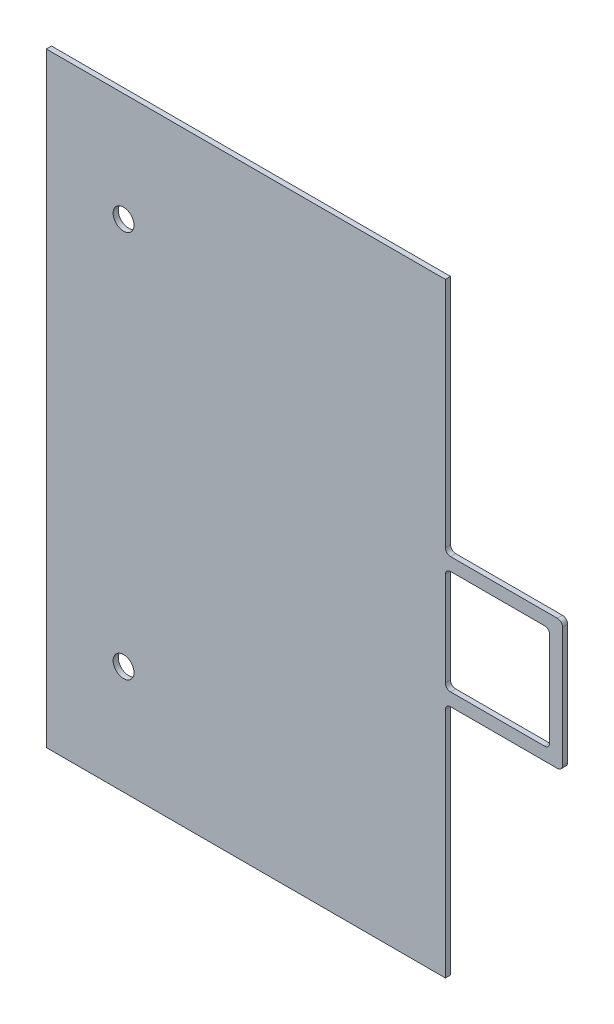
from build123d import *

# Parameters (mm, degrees)
SKETCH9_R          = 8.1
BASE_FLANGE2_DEPTH = 4


# Sheet-metal steps are written as plain solids
with BuildPart() as part:
    # Sketch9 → Base-Flange2 (new body)
    with BuildSketch(Plane.XY):
        with BuildLine():
            Line((-155, -235), (155, -235))
            Line((155, -235), (155, -54.5))
            ThreePointArc((155, -54.5), (156.171572875, -51.671572875), (159, -50.5))
            Line((159, -50.5), (242, -50.5))
            ThreePointArc((242, -50.5), (244.828427125, -49.328427125), (246, -46.5))
            Line((246, -46.5), (246, 46.5))
            ThreePointArc((246, 46.5), (244.828427125, 49.328427125), (242, 50.5))
            Line((242, 50.5), (159, 50.5))
            ThreePointArc((159, 50.5), (156.171572875, 51.671572875), (155, 54.5))
            Line((155, 54.5), (155, 235))
            Line((155, 235), (-155, 235))
            Line((-155, 235), (-155, -235))
        make_face()
        with Locations((-95, 150.5)):
            Circle(SKETCH9_R, mode=Mode.SUBTRACT)
        with Locations((-95, -150.5)):
            Circle(SKETCH9_R, mode=Mode.SUBTRACT)
        with BuildLine():
            Line((159, 40.5), (232, 40.5))
            ThreePointArc((232, 40.5), (234.828427125, 39.328427125), (236, 36.5))
            Line((236, 36.5), (236, -36.5))
            ThreePointArc((236, -36.5), (234.828427125, -39.328427125), (232, -40.5))
            Line((232, -40.5), (159, -40.5))
            ThreePointArc((159, -40.5), (156.171572875, -39.328427125), (155, -36.5))
            Line((155, -36.5), (155, 36.5))
            ThreePointArc((155, 36.5), (156.171572875, 39.328427125), (159, 40.5))
        make_face(mode=Mode.SUBTRACT)
    extrude(amount=-BASE_FLANGE2_DEPTH)


solid = part.part
